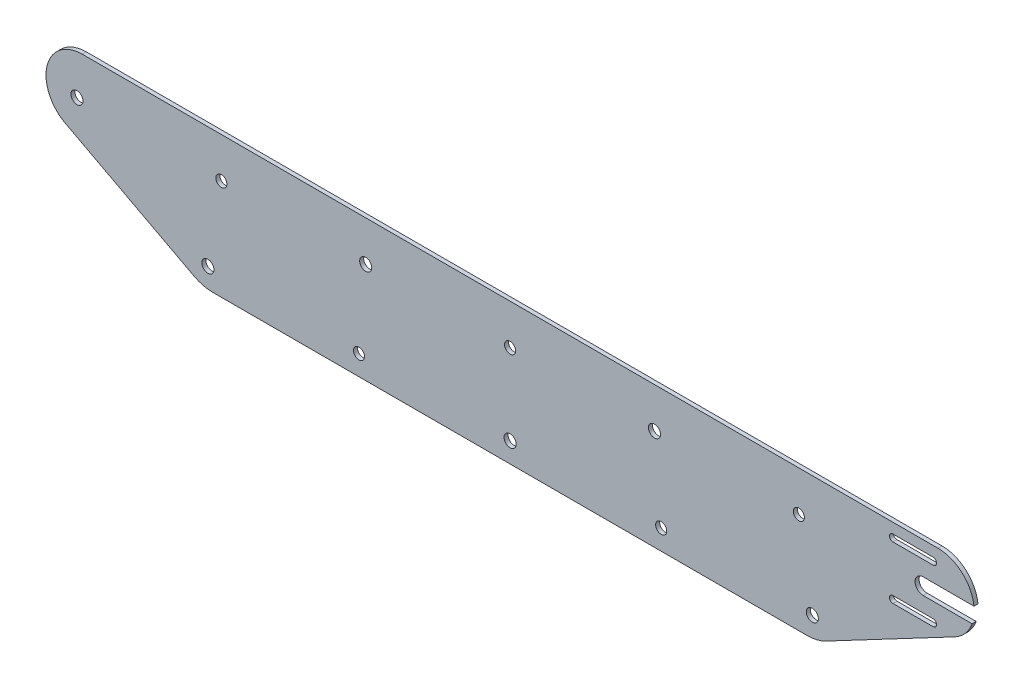
from build123d import *

# Parameters (mm, degrees)
ESQUISSE1_R             = 3
BOSS_EXTRU_1_DEPTH      = 2
CONG_1_R                = 18
CONG_2_R                = 20
D_GAGEMENT_M31_D        = 3.4
ENL_V_MAT_EXTRU_1_DEPTH = 234.819122898
D_GAGEMENT_M51_D        = 5.5
D_GAGEMENT_M52_D        = 5.5


with BuildPart() as part:
    # Esquisse1 → Boss.-Extru.1 (new body)
    with BuildSketch(Plane.XY):
        Polygon((-284.958991582, 40), (-150, 40), (150, 40), (284.958991582, 40), (152.479495791, -30), (-152.479495791, -30), align=None)
        with Locations((-215, 20)):
            Circle(ESQUISSE1_R, mode=Mode.SUBTRACT)
        with Locations((-150, -20)):
            Circle(ESQUISSE1_R, mode=Mode.SUBTRACT)
        with Locations((150, -20)):
            Circle(ESQUISSE1_R, mode=Mode.SUBTRACT)
        with Locations((215, 20)):
            Circle(ESQUISSE1_R, mode=Mode.SUBTRACT)
        with Locations((0, -20)):
            Circle(ESQUISSE1_R, mode=Mode.SUBTRACT)
        with Locations((-71.666666667, 20)):
            Circle(ESQUISSE1_R, mode=Mode.SUBTRACT)
        with Locations((71.666666667, 20)):
            Circle(ESQUISSE1_R, mode=Mode.SUBTRACT)
    extrude(amount=BOSS_EXTRU_1_DEPTH)

    # Congé1
    cong_1_edges = [part.edges().sort_by_distance(p)[0] for p in [
        (-284.958991582, 40, 1),
        (284.958991582, 40, 1),
    ]]
    fillet(cong_1_edges, radius=CONG_1_R)

    # Congé2
    cong_2_edges = [part.edges().sort_by_distance(p)[0] for p in [
        (-152.479495791, -30, 1),
        (152.479495791, -30, 1),
    ]]
    fillet(cong_2_edges, radius=CONG_2_R)

    # Dégagement M31 (through all)
    with Locations(Plane(origin=(0, 0, 0), x_dir=(-1, 0, 0), z_dir=(0, 0, -1))):
        with Locations((-200, 33.228756555), (-200, 6.771243445)):
            Hole(D_GAGEMENT_M31_D / 2)

    # Esquisse4 → Enlèv. mat.-Extru.1 (cut, through all)
    with BuildSketch(Plane(origin=(0, 0, 0), x_dir=(-1, 0, 0), z_dir=(0, 0, -1))):
        with BuildLine():
            Line((-229.334149786, 16), (-205, 16))
            ThreePointArc((-205, 16), (-201, 20), (-205, 24))
            Line((-205, 24), (-230.252130857, 24))
            ThreePointArc((-230.252130857, 24), (-230.246241418, 19.948007721), (-229.334149786, 16))
        make_face()
        with BuildLine():
            Line((-210, 31.528756555), (-190, 31.528756555))
            ThreePointArc((-190, 31.528756555), (-188.3, 33.228756555), (-190, 34.928756555))
            Line((-190, 34.928756555), (-210, 34.928756555))
            ThreePointArc((-210, 34.928756555), (-211.7, 33.228756555), (-210, 31.528756555))
        make_face()
        with BuildLine():
            Line((-210, 5.071243445), (-190, 5.071243445))
            ThreePointArc((-190, 5.071243445), (-188.3, 6.771243445), (-190, 8.471243445))
            Line((-190, 8.471243445), (-210, 8.471243445))
            ThreePointArc((-210, 8.471243445), (-211.7, 6.771243445), (-210, 5.071243445))
        make_face()
    extrude(amount=-ENL_V_MAT_EXTRU_1_DEPTH, mode=Mode.SUBTRACT)

    # Dégagement M51 (through all)
    with Locations(Plane(origin=(0, 0, 0), x_dir=(-1, 0, 0), z_dir=(0, 0, -1))):
        with Locations((143.333333333, 20), (0, 20), (-143.333333333, 20)):
            Hole(D_GAGEMENT_M51_D / 2)

    # Dégagement M52 (through all)
    with Locations(Plane.XY.offset(2)):
        with Locations((-75, -20), (75, -20)):
            Hole(D_GAGEMENT_M52_D / 2)


solid = part.part
